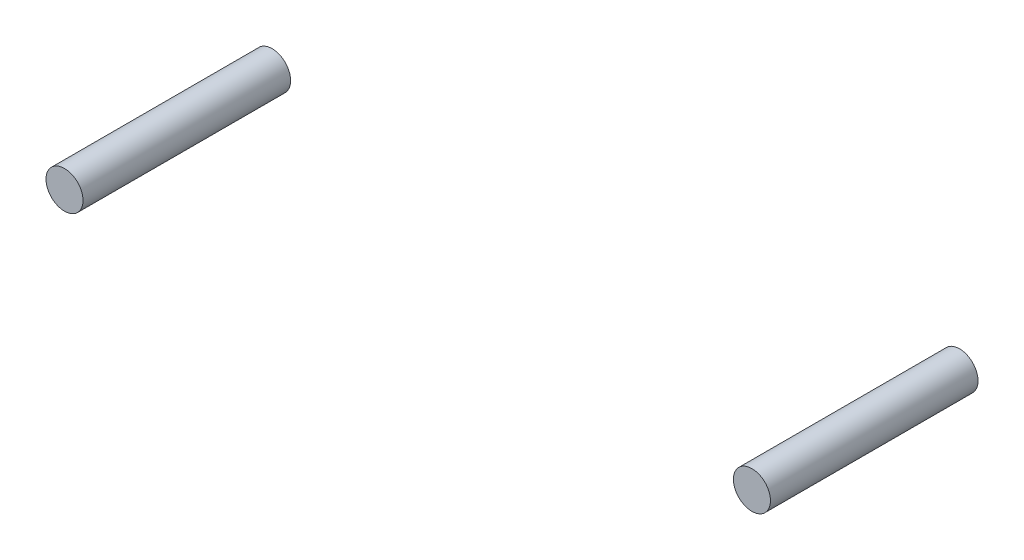
from build123d import *

# Parameters (mm, degrees)
BOSS_EXTRUDE1_START     = -71.1581
BOSS_EXTRUDE1_OUTLINE_R = 6.35
BOSS_EXTRUDE1_DEPTH     = 71.1581


# Read off the part's stored shape, not the designer's step: Boss-Extrude1
with BuildPart() as part:
    # Boss-Extrude1 outline → Boss-Extrude1 (new body)
    with BuildSketch(Plane(origin=(0, 0, -22.86), x_dir=(-1, 0, 0), z_dir=(0, 0, -1)).offset(BOSS_EXTRUDE1_START)):
        Circle(BOSS_EXTRUDE1_OUTLINE_R)
        with Locations((235.644133072, -28.715891479)):
            Circle(BOSS_EXTRUDE1_OUTLINE_R)
    extrude(amount=BOSS_EXTRUDE1_DEPTH)


solid = part.part
